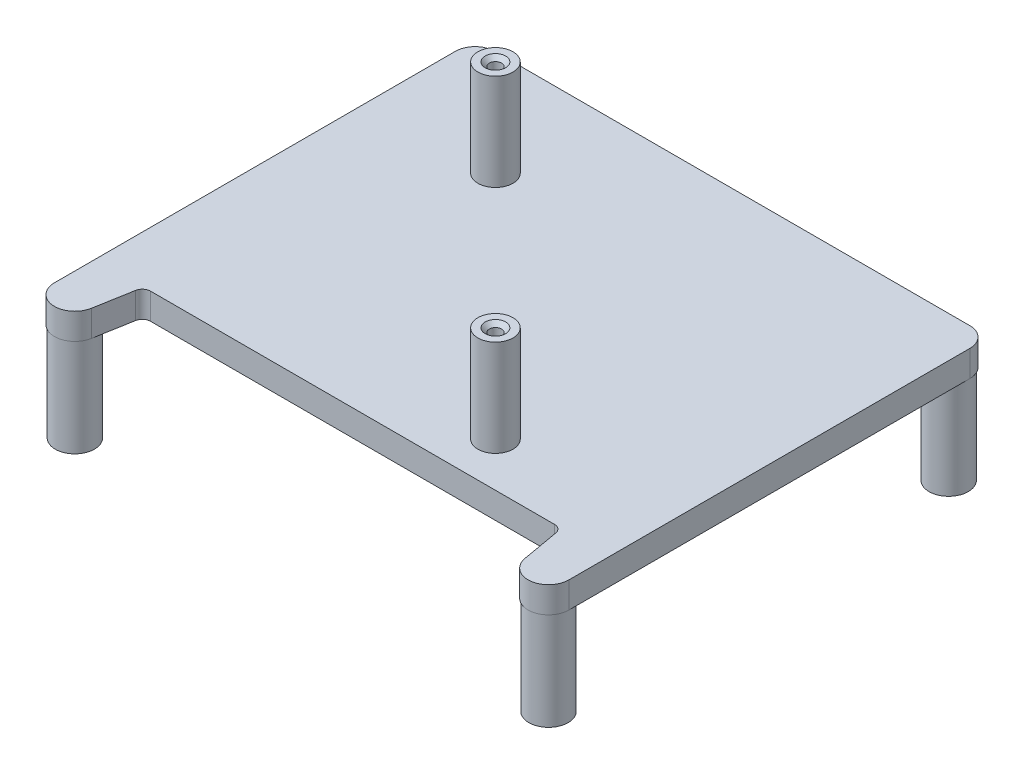
from build123d import *

# Parameters (mm, degrees)
BOSS_EXTRUDE1_DEPTH = 3.2
SKETCH2_R           = 2.4
SKETCH2_R_2         = 0.75
BOSS_EXTRUDE2_DEPTH = 12
SKETCH3_R           = 2.15
SKETCH3_R_2         = 0.75
BOSS_EXTRUDE3_DEPTH = 11.8
CHAMFER1_SIZE       = 0.5
CHAMFER2_SIZE       = 1.9
CHAMFER2_SIZE_2     = 10.775435457
FILLET1_R           = 2.4
FILLET2_R           = 2.501224
FILLET3_R           = 2.501224
FILLET4_R           = 1


# Some blends are built 0.0001 mm under size
with BuildPart() as part:
    # Sketch1 → Boss-Extrude1 (new body)
    with BuildSketch(Plane(origin=(0, 0, 0), x_dir=(1, 0, 0), z_dir=(0, 1, 0))):
        Polygon((31.5, 27), (-31.5, 27), (-31.5, -27), (-25, -27), (-25, -19.5), (25, -19.5), (25, -27), (31.5, -27), align=None)
    extrude(amount=BOSS_EXTRUDE1_DEPTH)

    # Sketch2 → Boss-Extrude2 (add)
    # profile 1 of 4: a face of its own
    with BuildSketch(Plane.XZ):
        with Locations(Location((-29, -24.5, 0), (0, 0, 90))):
            Circle(SKETCH2_R)
        with Locations(Location((-29, -24.5, 0), (0, 0, 270))):
            Circle(SKETCH2_R_2, mode=Mode.SUBTRACT)
    # profile 2 of 4: a face of its own
    with BuildSketch(Plane.XZ):
        with Locations(Location((29, -24.5, 0), (0, 0, 90))):
            Circle(SKETCH2_R)
        with Locations(Location((29, -24.5, 0), (0, 0, 90))):
            Circle(SKETCH2_R_2, mode=Mode.SUBTRACT)
    # profile 3 of 4: a face of its own
    with BuildSketch(Plane.XZ):
        with Locations(Location((29, 24.5, 0), (0, 0, 90))):
            Circle(SKETCH2_R)
        with Locations(Location((29, 24.5, 0), (0, 0, 270))):
            Circle(SKETCH2_R_2, mode=Mode.SUBTRACT)
    # profile 4 of 4: a face of its own
    with BuildSketch(Plane.XZ):
        with Locations(Location((-29, 24.5, 0), (0, 0, 90))):
            Circle(SKETCH2_R)
        with Locations(Location((-29, 24.5, 0), (0, 0, 90))):
            Circle(SKETCH2_R_2, mode=Mode.SUBTRACT)
    extrude(amount=BOSS_EXTRUDE2_DEPTH)

    # Sketch3 → Boss-Extrude3 (add)
    # profile 1 of 2: a face of its own
    with BuildSketch(Plane(origin=(0, 3.2, 0), x_dir=(1, 0, 0), z_dir=(0, 1, 0))):
        with Locations(Location((-16.125, 14.125, 0), (0, 0, 270))):
            Circle(SKETCH3_R)
        with Locations(Location((-16.125, 14.125, 0), (0, 0, 270))):
            Circle(SKETCH3_R_2, mode=Mode.SUBTRACT)
    # profile 2 of 2: a face of its own
    with BuildSketch(Plane(origin=(0, 3.2, 0), x_dir=(1, 0, 0), z_dir=(0, 1, 0))):
        with Locations(Location((12.075, -14.075, 0), (0, 0, 270))):
            Circle(SKETCH3_R)
        with Locations(Location((12.075, -14.075, 0), (0, 0, 270))):
            Circle(SKETCH3_R_2, mode=Mode.SUBTRACT)
    extrude(amount=BOSS_EXTRUDE3_DEPTH)

    # Chamfer1
    chamfer1_edges = [part.edges().sort_by_distance(p)[0] for p in [
        (-29, -12, -23.75),
        (29, -12, -25.25),
        (29, -12, 25.25),
        (-29, -12, 23.75),
        (-16.125, 15, -14.875),
        (12.075, 15, 13.325),
    ]]
    chamfer(chamfer1_edges, length=CHAMFER1_SIZE)

    # Chamfer2
    # the kernel refuses this chamfer: 10.775435457, 1.9 mm, written as the material it takes off along each edge
    with BuildSketch(Plane(origin=(25, -28.000387084, 27), x_dir=(0.9776715712462577, 0, 0.2101387607674357), z_dir=(0, 1, 0))) as chamfer2_piece_1_section:
        Polygon((CHAMFER2_SIZE * 0.977671571246, CHAMFER2_SIZE * 0.210138760767), (-CHAMFER2_SIZE_2 * 0.210138760773, CHAMFER2_SIZE_2 * 0.977671571271), (0, 0), align=None)
    chamfer2_piece_1 = extrude(amount=59.200774168, mode=Mode.PRIVATE)
    chamfer2_piece_1 = split(chamfer2_piece_1, bisect_by=Plane(origin=(25.592384699, 1.6, 19.5), z_dir=(0, 0, 1)), keep=Keep.TOP, mode=Mode.PRIVATE)
    add(chamfer2_piece_1, mode=Mode.SUBTRACT)
    with BuildSketch(Plane(origin=(-25, -28.000387084, 27), x_dir=(0.006682531656101439, 0, -0.9999776716360547), z_dir=(0, 1, 0))) as chamfer2_piece_2_section:
        Polygon((CHAMFER2_SIZE_2 * 0.999977671661, CHAMFER2_SIZE_2 * 0.00668253165627), (-CHAMFER2_SIZE * 0.0066825316561, CHAMFER2_SIZE * 0.999977671636), (0, 0), align=None)
    chamfer2_piece_2 = extrude(amount=59.200774168, mode=Mode.PRIVATE)
    chamfer2_piece_2 = split(chamfer2_piece_2, bisect_by=Plane(origin=(-25.592384699, 1.6, 19.5), z_dir=(0, 0, 1)), keep=Keep.TOP, mode=Mode.PRIVATE)
    add(chamfer2_piece_2, mode=Mode.SUBTRACT)

    # Fillet1
    fillet1_edges = [part.edges().sort_by_distance(p)[0] for p in [
        (-31.5, 1.6, -27),
        (31.5, 1.6, -27),
    ]]
    fillet(fillet1_edges, radius=FILLET1_R)

    # Fillet2
    fillet2_edges = [part.edges().sort_by_distance(p)[0] for p in [
        (31.5, 1.6, 27),
        (26.9, 1.6, 27),
    ]]
    fillet(fillet2_edges, radius=FILLET2_R - 0.0001)  # a hair under: the kernel refuses the full size

    # Fillet3
    fillet3_edges = [part.edges().sort_by_distance(p)[0] for p in [
        (-31.5, 1.6, 27),
        (-26.9, 1.6, 27),
    ]]
    fillet(fillet3_edges, radius=FILLET3_R - 0.0001)  # a hair under: the kernel refuses the full size

    # Fillet4
    fillet4_edges = [part.edges().sort_by_distance(p)[0] for p in [
        (25.577547645, 1.6, 19.5),
        (-25.577547645, 1.6, 19.5),
    ]]
    fillet(fillet4_edges, radius=FILLET4_R)


solid = part.part
